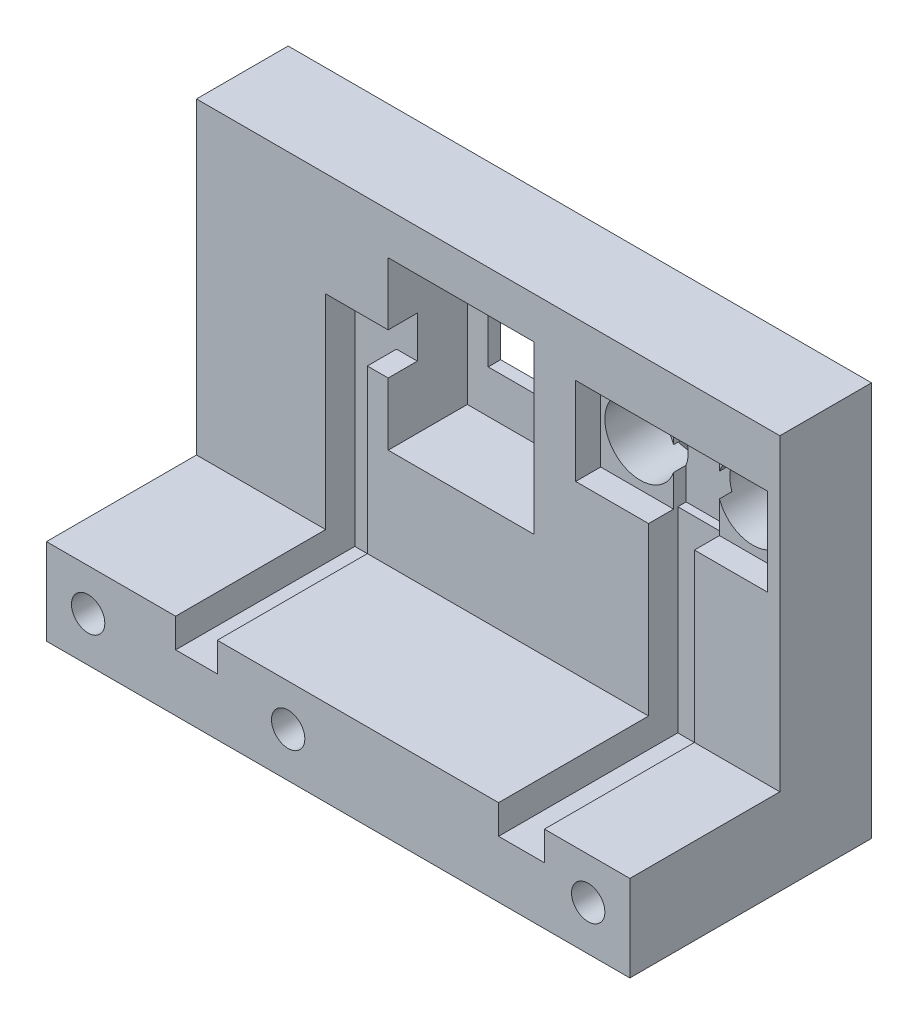
from build123d import *
from build123d.topology import SkipClean

# Parameters (mm, degrees)
BOTTOM_SECTION_DEPTH                           = 36
PIR_HOUSING_DEPTH                              = 40
SKETCH3_W                                      = 52
SKETCH3_H                                      = 74
SONAR_HOUSING_DEPTH                            = 19
SKETCH4_W                                      = 92
SKETCH4_H                                      = 77.697427805
BACKING_DEPTH                                  = 10
SKETCH6_W                                      = 46
SKETCH6_H                                      = 21
MAIN_ENCLOSURE_FOR_SONAR_DEPTH                 = 6
SKETCH7_W                                      = 11
SKETCH7_H                                      = 3
GAP_FOR_SONAR_WIRING_DEPTH                     = 3
SKETCH8_R                                      = 8.5
F_2_HOLES_FOR_SONAR_DEPTH                      = 13
SKETCH11_W                                     = 11
SKETCH11_H                                     = 21
CENTER_GAP_FOR_SONAR_COMPONENT_DEPTH           = 3
MAIN_ENCLOSURE_FOR_PIR_SENSOR_T                = -3
SKETCH20_R                                     = 11.5
HOLE_FOR_PIR_SENSOR_DEPTH                      = 3
SKETCH21_W                                     = 34
SKETCH21_H                                     = 41.306729328
EXTRUDE_TO_FILL_UP_BOTTOM_SPACE_OF_PIR_C_DEPTH = 16
SKETCH22_W                                     = 92
SKETCH22_H                                     = 36
ELEVATED_MATERIAL_FOR_BASE_DEPTH               = 10
BASE_START                                     = -92
SKETCH24_W                                     = 19
SKETCH24_H                                     = 3.697427805
BASE_MATERIAL_FOR_PIR_AND_SONAR_CASING_O_DEPTH = 92
ADDITIONAL_MATERIAL_TO_INCREASE_HEIGHT_O_DEPTH = 10
SKETCH56_W                                     = 34
SKETCH56_H                                     = 13
EXTRA_UPPER_SPACE_TO_FIT_PIR_SENSOR_DEPTH      = 10
SKETCH54_W                                     = 92
SKETCH54_H                                     = 10
CUT_TO_REMOVE_BACKING_THAT_CAN_T_BE_REMO_DEPTH = 77.697428
SKETCH60_R                                     = 4
BOSS_EXTRUDE1_DEPTH                            = 27
SKETCH60_6_R                                   = 4
CUT_TO_REMOVE_THE_RODS_STICKING_OUT_THAT_DEPTH = 144.216056515
CUT_EXTRUDE15_REACH                            = 110.124
SKETCH81_W                                     = 34
SKETCH81_H                                     = 10
BOSS_EXTRUDE7_DEPTH                            = 6.284444
SKETCH86_W                                     = 34
SKETCH86_H                                     = 26.693270672
BOSS_EXTRUDE9_DEPTH                            = 19
ADDITION_OF_MATERIAL_TO_SIDE_48MM_DEPTH        = 48
SKETCH82_W                                     = 35
SKETCH82_H                                     = 40
CUT_EXTRUDE20_DEPTH                            = 19
SKETCH88_W                                     = 140
SKETCH88_H                                     = 87.697427805
SKETCH88_R                                     = 8.5
SKETCH88_W_2                                   = 35
SKETCH88_H_2                                   = 40
BOSS_EXTRUDE11_DEPTH                           = 3
SKETCH91_W                                     = 140
SKETCH91_H                                     = 58
ADDITION_OF_MATERIAL_TO_BASE_7MM_DEPTH         = 7
CHAMFER1_SIZE                                  = 4
CHAMFER2_SIZE                                  = 4
SKETCH82_3_W                                   = 25
SKETCH82_3_H                                   = 22.193270672
CUT_EXTRUDE21_DEPTH                            = 133.101623304
SKETCH89_W                                     = 10
SKETCH89_H                                     = 46
SKETCH89_W_2                                   = 11
SKETCH89_H_2                                   = 3
SKETCH89_H_3                                   = 44
CUT_EXTRUDE22_DEPTH                            = 7
SKETCH90_W                                     = 11
SKETCH90_H                                     = 36
SKETCH90_W_2                                   = 10
CUT_EXTRUDE23_DEPTH                            = 7
SKETCH60_5_R                                   = 4
CUT_EXTRUDE6_DEPTH                             = 15
SKETCH93_R                                     = 4
CUT_EXTRUDE24_DEPTH                            = 15
SKETCH94_W                                     = 5
SKETCH94_H                                     = 0.897435897
CUT_EXTRUDE25_DEPTH                            = 2


with BuildPart() as part:
    # Sketch1 → Bottom section (new body)
    with BuildSketch(Plane.XY):
        Polygon((0, 3.697427805), (0, 0), (92, 0), (92, 3.697427805), (31.954921356, 3.697427805), align=None)
    extrude(amount=BOTTOM_SECTION_DEPTH)

    # Sketch4 → Backing (add)
    with BuildSketch(Plane.XY.offset(36)):
        with Locations((46, 38.848713903)):
            Rectangle(SKETCH4_W, SKETCH4_H)
    extrude(amount=BACKING_DEPTH)



with BuildPart() as body_2:
    # Sketch2 → PIR Housing (new body)
    with BuildSketch(Plane.ZY.offset(-40)):
        Polygon((0, 3.697427805), (0, 77.697427805), (-30, 77.697427805), (-19, 47.475176191), (-19, 3.697427805), align=None)
    extrude(amount=PIR_HOUSING_DEPTH)

    # Main Enclosure for PIR sensor
    main_enclosure_for_pir_sensor_openings = [body_2.faces().sort_by_distance(p)[0] for p in [
        (20, 40.697427805, 0),
    ]]
    offset(amount=MAIN_ENCLOSURE_FOR_PIR_SENSOR_T, openings=main_enclosure_for_pir_sensor_openings, kind=Kind.INTERSECTION)

    # Sketch20 → Hole for PIR sensor (cut)
    with BuildSketch(Plane(origin=(0, -0.55294165, -1.519194698), x_dir=(-1, 0, 0), z_dir=(0, -0.34202014332566627, -0.9396926207859093))):
        with Locations(Location((-20, 67.191379661, 0), (0, 0, 90))):
            Circle(SKETCH20_R)
    extrude(amount=-HOLE_FOR_PIR_SENSOR_DEPTH, mode=Mode.SUBTRACT)

    # Sketch21 → Extrude to Fill up bottom space of PIR cavity (add)
    with BuildSketch(Plane.XY.offset(-16)):
        with Locations((20, 27.350792469)):
            Rectangle(SKETCH21_W, SKETCH21_H)
    extrude(amount=EXTRUDE_TO_FILL_UP_BOTTOM_SPACE_OF_PIR_C_DEPTH)


with BuildPart() as body_3:
    # Sketch3 → Sonar Housing (new body)
    with BuildSketch(Plane(origin=(0, 0, 0), x_dir=(-1, 0, 0), z_dir=(0, 0, -1))):
        with Locations((-66, 40.697427805)):
            Rectangle(SKETCH3_W, SKETCH3_H)
    extrude(amount=SONAR_HOUSING_DEPTH)

    # Sketch6 → Main enclosure for sonar (cut)
    with BuildSketch(Plane.XY):
        with Locations((66, 64.197427805)):
            Rectangle(SKETCH6_W, SKETCH6_H)
    extrude(amount=-MAIN_ENCLOSURE_FOR_SONAR_DEPTH, mode=Mode.SUBTRACT)

    # Sketch7 → Gap for Sonar Wiring (cut)
    with BuildSketch(Plane.XY):
        with Locations((66, 52.197427805)):
            Rectangle(SKETCH7_W, SKETCH7_H)
    extrude(amount=-GAP_FOR_SONAR_WIRING_DEPTH, mode=Mode.SUBTRACT)

    # Sketch8 → 2 Holes for Sonar (cut)
    with BuildSketch(Plane.XY.offset(-6)):
        with Locations((79.500013879, 64.197427805)):
            Circle(SKETCH8_R)
        with Locations((52.5, 64.197427805)):
            Circle(SKETCH8_R)
    extrude(amount=-F_2_HOLES_FOR_SONAR_DEPTH, mode=Mode.SUBTRACT)

    # Sketch11 → Center gap for sonar component (cut)
    with BuildSketch(Plane.XY.offset(-6)):
        with Locations((66, 64.197427805)):
            Rectangle(SKETCH11_W, SKETCH11_H)
    extrude(amount=-CENTER_GAP_FOR_SONAR_COMPONENT_DEPTH, mode=Mode.SUBTRACT)


with BuildPart() as body_4:
    # Sketch22 → Elevated material for base (new body)
    with BuildSketch(Plane(origin=(0, 3.697427805, 0), x_dir=(1, 0, 0), z_dir=(0, 1, 0))):
        with Locations((46, -18)):
            Rectangle(SKETCH22_W, SKETCH22_H)
    extrude(amount=ELEVATED_MATERIAL_FOR_BASE_DEPTH)


with BuildPart() as part_1:
    add(part.part)

    add(body_3.part)  # Base Material for PIR and Sonar casing overhang merges body 3

    add(body_2.part)  # Base Material for PIR and Sonar casing overhang merges body 2
    # Sketch24 → Base Material for PIR and Sonar casing overhang (add)
    with BuildSketch(Plane(origin=(92, 0, 0), x_dir=(0, 0, -1), z_dir=(1, 0, 0)).offset(BASE_START)):
        with Locations((9.5, 1.848713903)):
            Rectangle(SKETCH24_W, SKETCH24_H)
    extrude(amount=BASE_MATERIAL_FOR_PIR_AND_SONAR_CASING_O_DEPTH)

    # Sketch29 → Additional material to increase height of casing (add)
    with BuildSketch(Plane(origin=(0, 77.697427805, 0), x_dir=(1, 0, 0), z_dir=(0, 1, 0))):
        Polygon((0, 30), (0, 0), (92, 0), (92, 19), (40, 19), (40, 30), align=None)
    extrude(amount=ADDITIONAL_MATERIAL_TO_INCREASE_HEIGHT_O_DEPTH)

    # Sketch56 → Extra Upper space to fit PIR sensor (cut)
    with BuildSketch(Plane.XZ.offset(-74.697427805)):
        with Locations((20, -19.21555598)):
            Rectangle(SKETCH56_W, SKETCH56_H)
    extrude(amount=-EXTRA_UPPER_SPACE_TO_FIT_PIR_SENSOR_DEPTH, mode=Mode.SUBTRACT)

    # Sketch54 → Cut to remove Backing that Can't be removed (cut)
    with BuildSketch(Plane(origin=(0, 77.697427805, 0), x_dir=(1, 0, 0), z_dir=(0, 1, 0))):
        with Locations((46, -41)):
            Rectangle(SKETCH54_W, SKETCH54_H)
    extrude(amount=-CUT_TO_REMOVE_BACKING_THAT_CAN_T_BE_REMO_DEPTH, mode=Mode.SUBTRACT)


    add(body_4.part)  # Boss-Extrude1 merges body 4
    # Sketch60 → Boss-Extrude1 (add)
    with BuildSketch(Plane.XY.offset(36)):
        with Locations(Location((28, 3.697427805, 0), (0, 0, 247.571587632))):
            Circle(SKETCH60_R)
        with Locations(Location((46, 3.697427805, 0), (0, 0, 247.571587632))):
            Circle(SKETCH60_R)
        with Locations(Location((64, 3.697427805, 0), (0, 0, 247.571587632))):
            Circle(SKETCH60_R)
    extrude(amount=BOSS_EXTRUDE1_DEPTH)

    # Sketch60<6> → Cut to remove the rods sticking out that could not be easily removed (cut, through all)
    with BuildSketch(Plane.XY.offset(36)):
        with Locations((28, 3.697427805)):
            Circle(SKETCH60_6_R)
        with Locations((46, 3.697427805)):
            Circle(SKETCH60_6_R)
        with Locations((64, 3.697427805)):
            Circle(SKETCH60_6_R)
        with Locations((10, 3.697427805)):
            Circle(SKETCH60_6_R)
        with Locations((82, 3.697427805)):
            Circle(SKETCH60_6_R)
    extrude(amount=CUT_TO_REMOVE_THE_RODS_STICKING_OUT_THAT_DEPTH, mode=Mode.SUBTRACT)

    # Sketch79 → Cut-Extrude15 (cut, up to next)
    with BuildSketch(Plane(origin=(40, 0, 0), x_dir=(0, 0, -1), z_dir=(1, 0, 0)), mode=Mode.PRIVATE) as cut_extrude15_sk1:
        Polygon((19, 87.697427805), (19, 47.475176191), (30, 77.697427805), (30, 87.697427805), align=None)
    cut_extrude15_tool1 = extrude(cut_extrude15_sk1.sketch, amount=-CUT_EXTRUDE15_REACH, mode=Mode.PRIVATE) & part_1.part
    add(cut_extrude15_tool1.solids().sort_by_distance((40, 73.626294, -23.396755))[0], mode=Mode.SUBTRACT)

    # Sketch81 → Boss-Extrude7 (add, through all)
    with BuildSketch(Plane(origin=(0, 0, -12.71555598), x_dir=(-1, 0, 0), z_dir=(0, 0, -1))):
        with Locations((-20, 79.697427805)):
            Rectangle(SKETCH81_W, SKETCH81_H)
    extrude(amount=BOSS_EXTRUDE7_DEPTH)

    # Sketch86 → Boss-Extrude9 (add, through all)
    with BuildSketch(Plane.XY):
        with Locations((20, 61.350792469)):
            Rectangle(SKETCH86_W, SKETCH86_H)
    extrude(amount=-BOSS_EXTRUDE9_DEPTH)

    # Sketch87 → Addition of material to side 48mm (add)
    with BuildSketch(Plane.ZY):
        Polygon((0, 87.697427805), (-19, 87.697427805), (-19, 0), (36, 0), (36, 13.697427805), (0, 13.697427805), align=None)
    extrude(amount=ADDITION_OF_MATERIAL_TO_SIDE_48MM_DEPTH)

    # Sketch82 → Cut-Extrude20 (cut)
    with BuildSketch(Plane.XY):
        with Locations((15.5, 57.697427805)):
            Rectangle(SKETCH82_W, SKETCH82_H)
    extrude(amount=-CUT_EXTRUDE20_DEPTH, mode=Mode.SUBTRACT)

    # Sketch88 → Boss-Extrude11 (add)
    # profile 1 of 2: a face of its own
    with SkipClean():  # the faces are left unmerged after this step: merging them gives an invalid solid
        with BuildSketch(Plane(origin=(0, 0, -19), x_dir=(-1, 0, 0), z_dir=(0, 0, -1))):
            with Locations((-22, 43.848713903)):
                Rectangle(SKETCH88_W, SKETCH88_H)
            with Locations(Location((-52.5, 64.197427805, 0), (0, 0, 199.749922796))):
                Circle(SKETCH88_R, mode=Mode.SUBTRACT)
            with Locations(Location((-79.500013879, 64.197427805, 0), (0, 0, 19.749645931))):
                Circle(SKETCH88_R, mode=Mode.SUBTRACT)
            with Locations((-15.5, 57.697427805)):
                Rectangle(SKETCH88_W_2, SKETCH88_H_2, mode=Mode.SUBTRACT)
        # profile 2 of 2: a face of its own
        with BuildSketch(Plane(origin=(0, 0, -19), x_dir=(-1, 0, 0), z_dir=(0, 0, -1))):
            with Locations((-15.5, 57.697427805)):
                Rectangle(SKETCH88_W_2, SKETCH88_H_2)
        extrude(amount=BOSS_EXTRUDE11_DEPTH)

    # Sketch91 → Addition of material to base 7mm (add)
    with SkipClean():  # the faces are left unmerged after this step: merging them gives an invalid solid
        with BuildSketch(Plane.XZ):
            with Locations((22, 7)):
                Rectangle(SKETCH91_W, SKETCH91_H)
        extrude(amount=ADDITION_OF_MATERIAL_TO_BASE_7MM_DEPTH)

    # Chamfer1
    chamfer1_edges = [part_1.edges().sort_by_distance(p)[0] for p in [
        (44.5, 67.069709128, -22),
    ]]
    chamfer(chamfer1_edges, length=CHAMFER1_SIZE)

    # Chamfer2
    chamfer2_edges = [part_1.edges().sort_by_distance(p)[0] for p in [
        (87.500027759, 61.325185139, -22),
    ]]
    chamfer(chamfer2_edges, length=CHAMFER2_SIZE - 0.0001)  # a hair under: the kernel refuses the full size

    # Sketch82<3> → Cut-Extrude21 (cut, through all)
    with BuildSketch(Plane.XY):
        with Locations((15.5, 59.100792469)):
            Rectangle(SKETCH82_3_W, SKETCH82_3_H)
    extrude(amount=-CUT_EXTRUDE21_DEPTH, mode=Mode.SUBTRACT)

    # Sketch89 → Cut-Extrude22 (cut)
    with BuildSketch(Plane.XY):
        Polygon((-2, 52.697427805), (-2, 62.697427805), (-17, 62.697427805), (-17, 52.697427805), (-7, 52.697427805), align=None)
        with Locations((-12, 29.697427805)):
            Rectangle(SKETCH89_W, SKETCH89_H)
        with Locations((66, 52.197427805)):
            Rectangle(SKETCH89_W_2, SKETCH89_H_2)
        with Locations((66, 28.697427805)):
            Rectangle(SKETCH89_W_2, SKETCH89_H_3)
    extrude(amount=-CUT_EXTRUDE22_DEPTH, mode=Mode.SUBTRACT)

    # Sketch90 → Cut-Extrude23 (cut)
    with BuildSketch(Plane(origin=(0, 13.697427805, 0), x_dir=(1, 0, 0), z_dir=(0, 1, 0))):
        with Locations((66, -18)):
            Rectangle(SKETCH90_W, SKETCH90_H)
        with Locations((-12, -18)):
            Rectangle(SKETCH90_W_2, SKETCH90_H)
    extrude(amount=-CUT_EXTRUDE23_DEPTH, mode=Mode.SUBTRACT)

    # Sketch60<5> → Cut-Extrude6 (cut)
    with BuildSketch(Plane.XY.offset(36)):
        with Locations((10, 3.697427805)):
            Circle(SKETCH60_5_R)
        with Locations((82, 3.697427805)):
            Circle(SKETCH60_5_R)
    extrude(amount=-CUT_EXTRUDE6_DEPTH, mode=Mode.SUBTRACT)

    # Sketch93 → Cut-Extrude24 (cut)
    with BuildSketch(Plane.XY.offset(36)):
        with Locations((-38, 3.697427805)):
            Circle(SKETCH93_R)
    extrude(amount=-CUT_EXTRUDE24_DEPTH, mode=Mode.SUBTRACT)

    # Sketch94 → Cut-Extrude25 (cut)
    # profile 1 of 8: a face of its own
    with BuildSketch(Plane(origin=(0, 0, -22), x_dir=(-1, 0, 0), z_dir=(0, 0, -1))):
        Polygon((25.171898431, 54.121750761), (25.171898431, 55.508970313), (30.171898431, 55.508970313), (30.171898431, 54.611534415), (26.005231764, 54.611534415), (26.005231764, 53.58589339), align=None)
    # profile 2 of 8: a face of its own
    with BuildSketch(Plane(origin=(0, 0, -22), x_dir=(-1, 0, 0), z_dir=(0, 0, -1))):
        Polygon((25.171898431, 46.534611338), (25.171898431, 47.342904608), (28.462162854, 49.611534415), (25.171898431, 49.611534415), (25.171898431, 50.508970313), (30.171898431, 50.508970313), (30.171898431, 49.694667428), (26.891650034, 47.432047236), (30.171898431, 47.432047236), (30.171898431, 46.534611338), align=None)
    # profile 3 of 8: a face of its own
    with BuildSketch(Plane(origin=(0, 0, -22), x_dir=(-1, 0, 0), z_dir=(0, 0, -1))):
        with BuildLine():
            add(Edge.make_bspline(
                [(25.043693303, 43.05103762), (25.045944543, 43.137968479), (25.050389002, 43.309589683), (25.087423514, 43.561987207), (25.14779959, 43.805200781), (25.23160761, 44.039206299), (25.341563379, 44.26294062), (25.472625009, 44.478584315), (25.630489313, 44.683406138), (25.809533837, 44.876698465), (26.004363693, 45.05527874), (26.214125435, 45.209979169), (26.433555536, 45.342263571), (26.663485586, 45.451092201), (26.904699501, 45.534687358), (27.156192127, 45.59309292), (27.41803158, 45.630663515), (27.596314039, 45.634981111), (27.686922469, 45.637175441)],
                knots=[0, 0, 0, 0, 1.014235534, 2.002330665, 2.970116157, 3.9352621, 4.897279957, 5.875024536, 6.875755618, 7.909865842, 8.947091691, 9.955591861, 10.946663836, 11.933282567, 12.91916997, 13.920121047, 14.942943865, 16, 16, 16, 16], degree=3))
            add(Edge.make_bspline(
                [(27.686922469, 45.637175441), (27.776509673, 45.634837815), (27.95304413, 45.63023145), (28.21247463, 45.594633982), (28.461258555, 45.535207522), (28.699901585, 45.453257807), (28.927200363, 45.346212852), (29.144103667, 45.216191717), (29.349867601, 45.061824724), (29.543625133, 44.886810519), (29.720697559, 44.695327993), (29.875723045, 44.491383169), (30.007055259, 44.277406569), (30.115206338, 44.053565778), (30.196790417, 43.818247794), (30.257797858, 43.574108875), (30.293088963, 43.319163347), (30.297741845, 43.145962352), (30.300103559, 43.058048838)],
                knots=[0, 0, 0, 0, 1.051628416, 2.072267533, 3.067761847, 4.050852917, 5.029392597, 6.012272624, 7.015026456, 8.044749159, 9.073964344, 10.072810436, 11.047668484, 12.017263184, 12.98554948, 13.966731695, 14.967951888, 16, 16, 16, 16], degree=3))
            add(Edge.make_bspline(
                [(30.300103559, 43.058048838), (30.29800956, 42.966094916), (30.293895138, 42.785418028), (30.255098926, 42.520930957), (30.195948933, 42.267890641), (30.110313976, 42.026990416), (29.999043271, 41.798417555), (29.864692387, 41.581147006), (29.704666151, 41.376812836), (29.523791227, 41.186096151), (29.325823061, 41.013326501), (29.11670057, 40.860818135), (28.898005222, 40.732175265), (28.669638842, 40.627391285), (28.433019579, 40.54478389), (28.186706645, 40.486513738), (27.931290708, 40.452092174), (27.757807101, 40.447297449), (27.669895226, 40.444867749)],
                knots=[0, 0, 0, 0, 1.067953136, 2.098381936, 3.099641766, 4.083805132, 5.062469929, 6.048665414, 7.046702845, 8.073106546, 9.098695993, 10.09591865, 11.076726721, 12.041940862, 13.011263376, 13.984305721, 14.978557872, 16, 16, 16, 16], degree=3))
            add(Edge.make_bspline(
                [(27.669895226, 40.444867749), (27.610752803, 40.445630552), (27.493216837, 40.447146499), (27.31903303, 40.465399065), (27.148254949, 40.491694414), (26.981535747, 40.530521072), (26.817501908, 40.577993869), (26.657614794, 40.638695982), (26.500790116, 40.708681542), (26.348785563, 40.789598146), (26.203351993, 40.881074714), (26.063239135, 40.978762295), (25.932113836, 41.086380552), (25.808577572, 41.201730106), (25.693103547, 41.325196529), (25.585811793, 41.457028724), (25.485474375, 41.596279769), (25.393423314, 41.742962468), (25.312055555, 41.895991897), (25.239190301, 42.051991196), (25.179374406, 42.211608634), (25.130125891, 42.373908785), (25.090548734, 42.538662271), (25.064245765, 42.707178582), (25.04600046, 42.878025444), (25.04446418, 42.993230031), (25.043693303, 43.05103762)],
                knots=[0, 0, 0, 0, 1.034634222, 2.056167603, 3.061938024, 4.056975325, 5.049831446, 6.048294015, 7.047371884, 8.053753139, 9.058980286, 10.052730068, 11.041053953, 12.024946181, 13.008838409, 13.997162294, 14.997691456, 16.01096975, 17.025258359, 18.029177048, 19.022170708, 20.005507574, 20.996177714, 21.984639769, 22.988728483, 24, 24, 24, 24], degree=3))
        make_face()
        with BuildLine():
            add(Edge.make_bspline(
                [(25.9411292, 43.037015184), (25.942699011, 42.978510547), (25.945797189, 42.863045804), (25.969401118, 42.693680054), (26.007099274, 42.531082953), (26.061704593, 42.37615584), (26.131203305, 42.228227249), (26.215352573, 42.087034948), (26.317044935, 41.954534158), (26.43082098, 41.828958109), (26.557593642, 41.715520813), (26.693452109, 41.615295383), (26.838169501, 41.531422841), (26.990401425, 41.461179062), (27.151859691, 41.408301064), (27.321279578, 41.370637652), (27.498953005, 41.346835781), (27.620072749, 41.343835526), (27.681914457, 41.342303646)],
                knots=[0, 0, 0, 0, 1.033739768, 2.040188636, 3.016340934, 3.979330865, 4.937572243, 5.900995986, 6.878200029, 7.884839167, 8.891893314, 9.879764717, 10.863503415, 11.843163062, 12.837761627, 13.859916423, 14.907309254, 16, 16, 16, 16], degree=3))
            add(Edge.make_bspline(
                [(27.681914457, 41.342303646), (27.750447, 41.344339345), (27.88475943, 41.348328978), (28.080724285, 41.376270734), (28.265968468, 41.424502505), (28.439572201, 41.492901478), (28.602513228, 41.57959047), (28.753873337, 41.685772334), (28.894364331, 41.811429915), (28.976410357, 41.908181825), (29.018052277, 41.95728762)],
                knots=[0, 0, 0, 0, 1.078420897, 2.113526272, 3.107597235, 4.084297302, 5.043369457, 6.005430726, 6.9876695, 8, 8, 8, 8], degree=3))
            add(Edge.make_bspline(
                [(29.018052277, 41.95728762), (29.048814191, 41.997518018), (29.109644947, 42.077072416), (29.187612039, 42.204058556), (29.254437615, 42.334829275), (29.30843189, 42.470371403), (29.35090288, 42.610398681), (29.380644615, 42.754891908), (29.399310126, 42.903646348), (29.401541008, 43.004241072), (29.402667662, 43.055044031)],
                knots=[0, 0, 0, 0, 1.023928204, 2.024787132, 3.009472467, 3.9914905, 4.972207045, 5.96565515, 6.972602802, 8, 8, 8, 8], degree=3))
            add(Edge.make_bspline(
                [(29.402667662, 43.055044031), (29.401082211, 43.112541502), (29.397962786, 43.225669585), (29.374682706, 43.391899315), (29.335105707, 43.551074481), (29.281383293, 43.704689884), (29.209305047, 43.850616338), (29.124151719, 43.991175265), (29.021799072, 44.123916282), (28.905625666, 44.248790932), (28.778407514, 44.363329908), (28.64250442, 44.464374918), (28.499180928, 44.549627169), (28.348460748, 44.619335313), (28.190509522, 44.673939847), (28.024843389, 44.711222167), (27.852217136, 44.735205477), (27.73474697, 44.738209289), (27.674903239, 44.739739543)],
                knots=[0, 0, 0, 0, 1.026460056, 2.019592442, 2.989754624, 3.951362471, 4.919177453, 5.890456226, 6.881277895, 7.906300149, 8.932084862, 9.933608786, 10.925308803, 11.904168404, 12.893913482, 13.903284022, 14.931853825, 16, 16, 16, 16], degree=3))
            add(Edge.make_bspline(
                [(27.674903239, 44.739739543), (27.615401448, 44.738161781), (27.498281248, 44.735056196), (27.326129915, 44.71164448), (27.161388607, 44.672723299), (27.003632663, 44.617715231), (26.852033874, 44.549186624), (26.707907989, 44.463103285), (26.571379701, 44.361331114), (26.44326069, 44.245730592), (26.325519633, 44.119927224), (26.223343809, 43.984859284), (26.134555745, 43.844312584), (26.065002886, 43.695060607), (26.009590237, 43.540157361), (25.968783576, 43.378657503), (25.945963008, 43.209949372), (25.942754832, 43.095173742), (25.9411292, 43.037015184)],
                knots=[0, 0, 0, 0, 1.055040155, 2.076685641, 3.074845078, 4.052329834, 5.035358467, 6.020382375, 7.023447318, 8.050688466, 9.077178457, 10.074336316, 11.0503314, 12.019748348, 12.988025369, 13.964577102, 14.968620271, 16, 16, 16, 16], degree=3))
        make_face(mode=Mode.SUBTRACT)
    # profile 4 of 8: a face of its own
    with BuildSketch(Plane(origin=(0, 0, -22), x_dir=(-1, 0, 0), z_dir=(0, 0, -1))):
        with Locations((27.671898431, 39.098713903)):
            Rectangle(SKETCH94_W, SKETCH94_H)
    # profile 5 of 8: a face of its own
    with BuildSketch(Plane(origin=(0, 0, -22), x_dir=(-1, 0, 0), z_dir=(0, 0, -1))):
        Polygon((25.171898431, 35.380765184), (25.171898431, 38.073072877), (26.069334328, 38.073072877), (26.069334328, 37.175636979), (30.171898431, 37.175636979), (30.171898431, 36.278201082), (26.069334328, 36.278201082), (26.069334328, 35.380765184), align=None)
    # profile 6 of 8: a face of its own
    with BuildSketch(Plane(origin=(0, 0, -22), x_dir=(-1, 0, 0), z_dir=(0, 0, -1))):
        Polygon((25.171898431, 32.30484371), (25.171898431, 33.137175441), (30.171898431, 35.15640621), (30.171898431, 34.197872556), (29.146257405, 33.809250761), (29.146257405, 31.630765184), (30.171898431, 31.24214339), (30.171898431, 30.284611338), align=None)
        Polygon((26.513044264, 32.720508774), (28.248821508, 31.971310056), (28.248821508, 33.469707492), align=None, mode=Mode.SUBTRACT)
    # profile 7 of 8: a face of its own
    with BuildSketch(Plane(origin=(0, 0, -22), x_dir=(-1, 0, 0), z_dir=(0, 0, -1))):
        Polygon((25.171898431, 27.367944672), (25.171898431, 30.060252364), (26.069334328, 30.060252364), (26.069334328, 29.162816466), (30.171898431, 29.162816466), (30.171898431, 28.265380569), (26.069334328, 28.265380569), (26.069334328, 27.367944672), align=None)
    # profile 8 of 8: a face of its own
    with BuildSketch(Plane(origin=(0, 0, -22), x_dir=(-1, 0, 0), z_dir=(0, 0, -1))):
        with BuildLine():
            Line((25.839967341, 26.855124159), (26.453949713, 26.184050441))
            add(Edge.make_bspline(
                [(26.453949713, 26.184050441), (26.413400604, 26.15530452), (26.335551968, 26.100116361), (26.231310811, 26.010662112), (26.142385346, 25.921611795), (26.069147063, 25.832140413), (26.012040939, 25.741454925), (25.971609173, 25.649712748), (25.945906315, 25.557433994), (25.942705691, 25.495436917), (25.9411292, 25.4648998)],
                knots=[0, 0, 0, 0, 1.299362458, 2.494594718, 3.587462134, 4.587049575, 5.512617175, 6.380583204, 7.202344345, 8, 8, 8, 8], degree=3))
            add(Edge.make_bspline(
                [(25.9411292, 25.4648998), (25.942098436, 25.436401594), (25.943969776, 25.381379046), (25.963506781, 25.303305683), (25.995077529, 25.233143577), (26.038687481, 25.172761656), (26.090770418, 25.124185715), (26.146215247, 25.086415019), (26.206668367, 25.064466394), (26.248128174, 25.061647757), (26.268653239, 25.060252364)],
                knots=[0, 0, 0, 0, 1.184157716, 2.286297433, 3.324836695, 4.370048774, 5.362957217, 6.276446515, 7.146738784, 8, 8, 8, 8], degree=3))
            add(Edge.make_bspline(
                [(26.268653239, 25.060252364), (26.289464649, 25.061135646), (26.331375939, 25.062914452), (26.392802153, 25.0800953), (26.452822714, 25.105991745), (26.489360086, 25.130736854), (26.508036252, 25.143385377)],
                knots=[0, 0, 0, 0, 0.967525499, 1.948461899, 2.951351359, 4, 4, 4, 4], degree=3))
            add(Edge.make_bspline(
                [(26.508036252, 25.143385377), (26.522511607, 25.154928932), (26.556024493, 25.181654209), (26.609903648, 25.231112019), (26.673587567, 25.295692115), (26.748399463, 25.373789614), (26.83504963, 25.465132075), (26.932090648, 25.571135621), (27.038578712, 25.692574758), (27.113652259, 25.777751412), (27.153068303, 25.822471915)],
                knots=[0, 0, 0, 0, 0.473854981, 1.097054127, 1.870604305, 2.795416232, 3.865517794, 5.093525133, 6.47400653, 8, 8, 8, 8], degree=3))
            add(Edge.make_bspline(
                [(27.153068303, 25.822471915), (27.18945818, 25.864540789), (27.258518607, 25.944378771), (27.356699987, 26.057828398), (27.444634935, 26.158180882), (27.522981935, 26.244523559), (27.588514557, 26.31943655), (27.645264459, 26.379606629), (27.690749079, 26.427608947), (27.718253297, 26.454868639), (27.72999138, 26.466502364)],
                knots=[0, 0, 0, 0, 1.543627419, 2.929484142, 4.163674036, 5.24627963, 6.164986907, 6.925413438, 7.541394495, 8, 8, 8, 8], degree=3))
            add(Edge.make_bspline(
                [(27.72999138, 26.466502364), (27.777764992, 26.51064032), (27.869602652, 26.595488971), (28.011886112, 26.705829863), (28.150661228, 26.796244552), (28.288195924, 26.867006677), (28.427665735, 26.919957655), (28.572078536, 26.957054321), (28.722530808, 26.979609516), (28.82499885, 26.982079826), (28.876826316, 26.983329287)],
                knots=[0, 0, 0, 0, 1.206593015, 2.319495511, 3.336910718, 4.276265636, 5.184178927, 6.099356736, 7.038670786, 8, 8, 8, 8], degree=3))
            add(Edge.make_bspline(
                [(28.876826316, 26.983329287), (28.92732406, 26.982434279), (29.026402515, 26.980678241), (29.171389079, 26.959170146), (29.310147497, 26.928500857), (29.441167958, 26.881080784), (29.566600837, 26.823285385), (29.684493352, 26.750830863), (29.796034598, 26.665741628), (29.899245964, 26.568221391), (29.992858073, 26.460333385), (30.076359877, 26.344683263), (30.144753503, 26.219697164), (30.203326808, 26.087864413), (30.245008657, 25.946778112), (30.277801071, 25.799009642), (30.297012881, 25.64302311), (30.299058489, 25.536399431), (30.300103559, 25.481927043)],
                knots=[0, 0, 0, 0, 1.043169307, 2.046737005, 3.02462096, 3.976528701, 4.921503154, 5.875710796, 6.831116189, 7.817539083, 8.805892356, 9.780872653, 10.7604363, 11.74661763, 12.757588865, 13.796088471, 14.874055702, 16, 16, 16, 16], degree=3))
            add(Edge.make_bspline(
                [(30.300103559, 25.481927043), (30.299345478, 25.439163585), (30.297844041, 25.354467413), (30.285568699, 25.229642111), (30.26580069, 25.109093651), (30.237316761, 24.993029955), (30.201718022, 24.880542974), (30.156272903, 24.772729208), (30.104029334, 24.668813847), (30.043864756, 24.5690105), (29.97394874, 24.473948522), (29.897018259, 24.38096384), (29.809346428, 24.29311935), (29.712635395, 24.208446394), (29.606292026, 24.128037617), (29.491930008, 24.049147741), (29.36738906, 23.975314587), (29.28002411, 23.929703395), (29.235400034, 23.90640621)],
                knots=[0, 0, 0, 0, 1.016956594, 2.014157282, 2.980233409, 3.920138626, 4.854357287, 5.783465618, 6.699725051, 7.61900777, 8.551402113, 9.504102091, 10.486778735, 11.499758944, 12.559144124, 13.656050795, 14.802762778, 16, 16, 16, 16], degree=3))
            Line((29.235400034, 23.90640621), (28.761642021, 24.695669031))
            add(Edge.make_bspline(
                [(28.761642021, 24.695669031), (28.812296326, 24.724810189), (28.909404959, 24.780676279), (29.039882715, 24.875346592), (29.151615314, 24.972331495), (29.242627877, 25.073873192), (29.314137358, 25.178736973), (29.365242995, 25.287429355), (29.396877326, 25.400026703), (29.400740608, 25.476722902), (29.402667662, 25.514979928)],
                knots=[0, 0, 0, 0, 1.283663364, 2.460892379, 3.537111102, 4.529833553, 5.449777664, 6.316464042, 7.160231139, 8, 8, 8, 8], degree=3))
            add(Edge.make_bspline(
                [(29.402667662, 25.514979928), (29.401093925, 25.553892801), (29.398040647, 25.629389441), (29.369838437, 25.737151235), (29.325558898, 25.835951327), (29.262378102, 25.921353397), (29.18945786, 25.993666486), (29.108330758, 26.047037696), (29.020553191, 26.08056585), (28.959577119, 26.084110589), (28.928909649, 26.08589339)],
                knots=[0, 0, 0, 0, 1.13588714, 2.203786484, 3.234766741, 4.283437687, 5.291419208, 6.222934724, 7.106237994, 8, 8, 8, 8], degree=3))
            add(Edge.make_bspline(
                [(28.928909649, 26.08589339), (28.900378559, 26.084247046), (28.84242038, 26.080902658), (28.756245888, 26.056268921), (28.670110586, 26.017758876), (28.599460081, 25.972198778), (28.540306328, 25.925835673), (28.489052278, 25.881502088), (28.432425525, 25.827515508), (28.370354837, 25.764012821), (28.302293791, 25.691833062), (28.228249051, 25.61091543), (28.148872863, 25.520333331), (28.094802588, 25.456309725), (28.066529841, 25.422832492)],
                knots=[0, 0, 0, 0, 0.916159276, 1.861089862, 2.860218735, 3.940849679, 4.552606315, 5.27541173, 6.11797699, 7.06649574, 8.129236253, 9.306560635, 10.591630461, 12, 12, 12, 12], degree=3))
            add(Edge.make_bspline(
                [(28.066529841, 25.422832492), (28.012683023, 25.359190887), (27.909334682, 25.237043383), (27.756691829, 25.064434311), (27.614035224, 24.908895102), (27.479592092, 24.771782138), (27.355874772, 24.651306522), (27.241784949, 24.548415716), (27.136519096, 24.46366113), (27.01100293, 24.375686451), (26.85941286, 24.291085274), (26.67714795, 24.217828564), (26.494722669, 24.170747656), (26.372084003, 24.165432532), (26.311722149, 24.162816466)],
                knots=[0, 0, 0, 0, 1.345561566, 2.582539916, 3.71901348, 4.751744315, 5.681651107, 6.506005906, 7.230637833, 7.861516384, 8.978504332, 10.023243174, 11.027054763, 12, 12, 12, 12], degree=3))
            add(Edge.make_bspline(
                [(26.311722149, 24.162816466), (26.26891485, 24.163901051), (26.184579874, 24.166037799), (26.060577248, 24.185097251), (25.940926421, 24.213583895), (25.826057851, 24.254948944), (25.716138089, 24.308656551), (25.610542873, 24.373804543), (25.510380711, 24.451918253), (25.414666347, 24.538828176), (25.328093434, 24.635738367), (25.251723507, 24.738866219), (25.186872193, 24.847759436), (25.13481413, 24.962837574), (25.093490322, 25.083160694), (25.064541338, 25.209032781), (25.047232993, 25.340217367), (25.0448879, 25.429456953), (25.043693303, 25.474915825)],
                knots=[0, 0, 0, 0, 1.010608097, 1.99100651, 2.956992389, 3.912457524, 4.868345712, 5.842283282, 6.837666818, 7.864758285, 8.892394644, 9.901925088, 10.892014243, 11.880216914, 12.880338321, 13.892361018, 14.926363314, 16, 16, 16, 16], degree=3))
            add(Edge.make_bspline(
                [(25.043693303, 25.474915825), (25.045848349, 25.533827133), (25.050141429, 25.651184723), (25.083713549, 25.824700472), (25.13650492, 25.99418675), (25.200205437, 26.13075126), (25.261881334, 26.239438433), (25.318756381, 26.322660103), (25.383661707, 26.40783759), (25.458426629, 26.49365245), (25.540598824, 26.582187823), (25.632072423, 26.672135691), (25.731906408, 26.764454207), (25.80331601, 26.824371376), (25.839967341, 26.855124159)],
                knots=[0, 0, 0, 0, 1.282949271, 2.555771389, 3.837399776, 5.142782039, 5.830402679, 6.558840402, 7.337330299, 8.162747002, 9.037840561, 9.968992266, 10.957575255, 12, 12, 12, 12], degree=3))
        make_face()
    extrude(amount=-CUT_EXTRUDE25_DEPTH, mode=Mode.SUBTRACT)


solid = part_1.part
